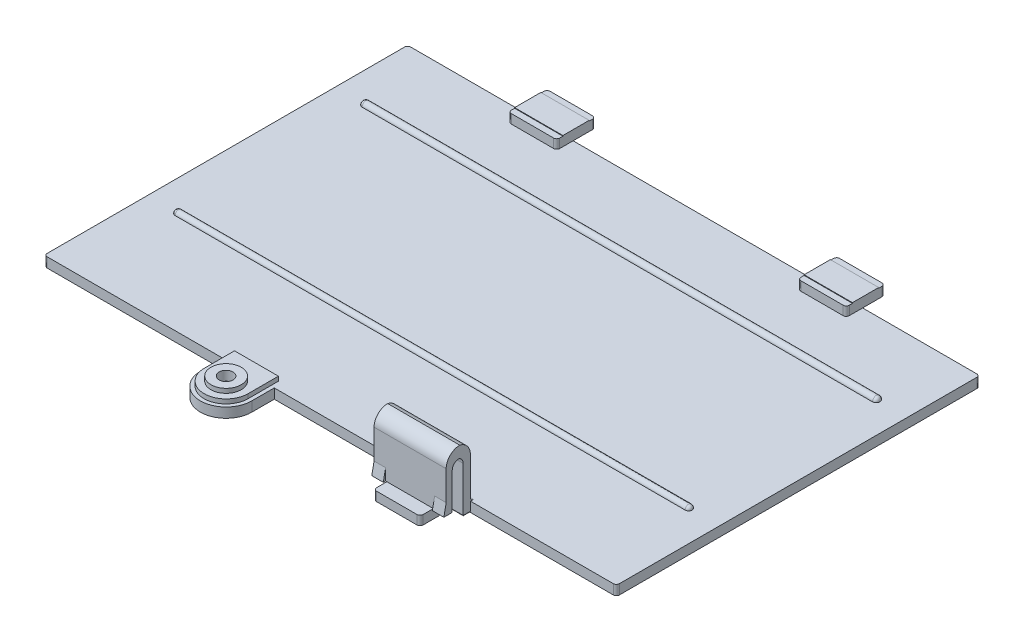
from build123d import *

# Parameters (mm, degrees)
CROQUIS1_W                    = 94.46
CROQUIS1_H                    = 60
SALIENTE_EXTRUIR1_DEPTH       = 1.62
CROQUIS2_W                    = 85.43
CROQUIS2_H                    = 1.25
SALIENTE_EXTRUIR3_DEPTH       = 0.7
CORTAR_EXTRUIR2_REACH         = 110.146
REDONDEO2_R                   = 0.575
REDONDEO3_R                   = 0.575
CROQUIS7_W                    = 85.365
CROQUIS7_H                    = 1.15
SALIENTE_EXTRUIR4_DEPTH       = 0.7
CORTAR_EXTRUIR3_REACH         = 110.092
REDONDEO4_R                   = 0.575
REDONDEO5_R                   = 0.575
CROQUIS9_W                    = 7.98
CROQUIS9_H                    = 6.39
SALIENTE_EXTRUIR6_DEPTH       = 1.6
CROQUIS10_W                   = 7.98
CROQUIS10_H                   = 1.03
CORTAR_EXTRUIR4_DEPTH         = 0.1
REDONDEO7_R                   = 0.5
REDONDEO8_R                   = 0.5
CROQUIS11_W                   = 7.98
CROQUIS11_H                   = 1.03
CORTAR_EXTRUIR5_DEPTH         = 0.1
REDONDEO10_R                  = 0.5
REDONDEO11_R                  = 0.5
REDONDEO13_R                  = 0.5
REDONDEO15_R                  = 0.5
SALIENTE_EXTRUIR8_DEPTH       = 1.48
SALIENTE_EXTRUIR8_DEPTH_BACK  = 1.62
CORTAR_EXTRUIR8_START         = -1.48
CORTAR_EXTRUIR8_DEPTH         = 1.48
CORTAR_EXTRUIR9_START         = -0.76
CORTAR_EXTRUIR9_DEPTH         = 0.76
CROQUIS17_R                   = 2.5
SALIENTE_EXTRUIR9_DEPTH       = 0.72
CROQUIS18_R                   = 1.15
CORTAR_EXTRUIR11_DEPTH        = 114.961386526
CROQUIS20_R                   = 2.36
CORTAR_EXTRUIR12_DEPTH        = 1.5
SALIENTE_EXTRUIR10_DEPTH      = 8.88
SALIENTE_EXTRUIR10_DEPTH_BACK = 1.62
CROQUIS21_W                   = 11.9
CROQUIS21_H                   = 1.18
CROQUIS22_W                   = 11.9
CROQUIS22_H                   = 1.86
SALIENTE_EXTRUIR11_DEPTH      = 2.82
CROQUIS23_W                   = 11.9
CROQUIS23_H                   = 1
SALIENTE_EXTRUIR12_DEPTH      = 8.64
REDONDEO16_R                  = 2.25
REDONDEO18_R                  = 0.5
REDONDEO19_R                  = 2.25
REDONDEO21_R                  = 1.125
REDONDEO22_R                  = 1.125
CROQUIS24_W                   = 7.68
CROQUIS24_H                   = 1.5
SALIENTE_EXTRUIR14_DEPTH      = 2.2
CORTAR_EXTRUIR13_REACH        = 118.677
CROQUIS26_W                   = 2.11
CROQUIS26_H                   = 1.5
REDONDEO25_R                  = 0.5
REDONDEO26_R                  = 0.5
SALIENTE_EXTRUIR21_DEPTH      = 1.9
SALIENTE_EXTRUIR22_DEPTH      = 1.9
REDONDEO27_R                  = 0.5
REDONDEO28_R                  = 0.5
REDONDEO29_R                  = 0.5
REDONDEO30_R                  = 0.5
CROQUIS30_W                   = 9
CROQUIS30_H                   = 1
SALIENTE_EXTRUIR23_DEPTH      = 0.1
REDONDEO31_R                  = 0.2
SALIENTE_EXTRUIR24_DEPTH      = 0.1
CROQUIS32_W                   = 1.8
CROQUIS32_H                   = 7
SALIENTE_EXTRUIR25_DEPTH      = 0.1


# Some blends are built 0.0001 mm under size
with BuildPart() as part:
    # Croquis1 → Saliente-Extruir1 (new body)
    with BuildSketch(Plane(origin=(0, 0, 0), x_dir=(1, 0, 0), z_dir=(0, 1, 0))):
        with Locations((47.23, 30)):
            Rectangle(CROQUIS1_W, CROQUIS1_H)
    extrude(amount=SALIENTE_EXTRUIR1_DEPTH)

    # Croquis2 → Saliente-Extruir3 (add)
    with BuildSketch(Plane(origin=(0, 1.62, 0), x_dir=(1, 0, 0), z_dir=(0, 1, 0))):
        with Locations((47.23, 48.015)):
            Rectangle(CROQUIS2_W, CROQUIS2_H)
    extrude(amount=SALIENTE_EXTRUIR3_DEPTH)

    # Croquis5 → Cortar-Extruir2 (cut, up to next)
    with BuildSketch(Plane.ZY.offset(-4.515), mode=Mode.PRIVATE) as cortar_extruir2_sk1:
        with BuildLine():
            Line((-48.64, 1.62), (-48.64, 2.32))
            Line((-48.64, 2.32), (-47.39, 2.32))
            Line((-47.39, 2.32), (-47.39, 1.62))
            ThreePointArc((-47.39, 1.62), (-48.015, 2.245), (-48.64, 1.62))
        make_face()
    cortar_extruir2_tool1 = extrude(cortar_extruir2_sk1.sketch, amount=-CORTAR_EXTRUIR2_REACH, mode=Mode.PRIVATE) & part.part
    add(cortar_extruir2_tool1.solids().sort_by_distance((4.515, 1.97, -48.625673))[0], mode=Mode.SUBTRACT)

    # Redondeo2
    redondeo2_edges = [part.edges().sort_by_distance(p)[0] for p in [
        (89.945, 2.245, -48.015),
    ]]
    fillet(redondeo2_edges, radius=REDONDEO2_R)

    # Redondeo3
    redondeo3_edges = [part.edges().sort_by_distance(p)[0] for p in [
        (4.515, 2.245, -48.015),
    ]]
    fillet(redondeo3_edges, radius=REDONDEO3_R)

    # Croquis7 → Saliente-Extruir4 (add)
    with BuildSketch(Plane(origin=(0, 1.62, 0), x_dir=(1, 0, 0), z_dir=(0, 1, 0))):
        with Locations((47.2625, 17.025)):
            Rectangle(CROQUIS7_W, CROQUIS7_H)
    extrude(amount=SALIENTE_EXTRUIR4_DEPTH)

    # Croquis8 → Cortar-Extruir3 (cut, up to next)
    with BuildSketch(Plane.ZY.offset(-4.58), mode=Mode.PRIVATE) as cortar_extruir3_sk1:
        with BuildLine():
            Line((-17.6, 1.62), (-17.6, 2.32))
            Line((-17.6, 2.32), (-16.45, 2.32))
            Line((-16.45, 2.32), (-16.45, 1.62))
            ThreePointArc((-16.45, 1.62), (-17.025, 2.195), (-17.6, 1.62))
        make_face()
    cortar_extruir3_tool1 = extrude(cortar_extruir3_sk1.sketch, amount=-CORTAR_EXTRUIR3_REACH, mode=Mode.PRIVATE) & part.part
    add(cortar_extruir3_tool1.solids().sort_by_distance((4.58, 1.97, -17.586537))[0], mode=Mode.SUBTRACT)

    # Redondeo4
    redondeo4_edges = [part.edges().sort_by_distance(p)[0] for p in [
        (4.58, 2.195, -17.025),
    ]]
    fillet(redondeo4_edges, radius=REDONDEO4_R - 0.0001)  # a hair under: the kernel refuses the full size

    # Redondeo5
    redondeo5_edges = [part.edges().sort_by_distance(p)[0] for p in [
        (89.945, 2.195, -17.025),
    ]]
    fillet(redondeo5_edges, radius=REDONDEO5_R - 0.0001)  # a hair under: the kernel refuses the full size

    # Croquis9 → Saliente-Extruir6 (add)
    with BuildSketch(Plane(origin=(0, 1.62, 0), x_dir=(1, 0, 0), z_dir=(0, 1, 0))):
        with Locations((23.33, 60.485)):
            Rectangle(CROQUIS9_W, CROQUIS9_H)
        with Locations((71.13, 60.485)):
            Rectangle(CROQUIS9_W, CROQUIS9_H)
    extrude(amount=SALIENTE_EXTRUIR6_DEPTH)

    # Croquis10 → Cortar-Extruir4 (cut)
    with BuildSketch(Plane(origin=(0, 3.22, 0), x_dir=(1, 0, 0), z_dir=(0, 1, 0))):
        with Locations((23.33, 63.165)):
            Rectangle(CROQUIS10_W, CROQUIS10_H)
        with Locations((23.33, 57.805)):
            Rectangle(CROQUIS10_W, CROQUIS10_H)
    extrude(amount=-CORTAR_EXTRUIR4_DEPTH, mode=Mode.SUBTRACT)

    # Redondeo7
    redondeo7_edges = [part.edges().sort_by_distance(p)[0] for p in [
        (19.34, 2.37, -63.68),
    ]]
    fillet(redondeo7_edges, radius=REDONDEO7_R)

    # Redondeo8
    redondeo8_edges = [part.edges().sort_by_distance(p)[0] for p in [
        (27.32, 2.37, -63.68),
        (27.32, 2.37, -57.29),
        (19.34, 2.37, -57.29),
    ]]
    fillet(redondeo8_edges, radius=REDONDEO8_R)

    # Croquis11 → Cortar-Extruir5 (cut)
    with BuildSketch(Plane(origin=(0, 3.22, 0), x_dir=(1, 0, 0), z_dir=(0, 1, 0))):
        with Locations((71.13, 63.165)):
            Rectangle(CROQUIS11_W, CROQUIS11_H)
        with Locations((71.13, 57.805)):
            Rectangle(CROQUIS11_W, CROQUIS11_H)
    extrude(amount=-CORTAR_EXTRUIR5_DEPTH, mode=Mode.SUBTRACT)

    # Redondeo10
    redondeo10_edges = [part.edges().sort_by_distance(p)[0] for p in [
        (75.12, 2.37, -57.29),
    ]]
    fillet(redondeo10_edges, radius=REDONDEO10_R)

    # Redondeo11
    redondeo11_edges = [part.edges().sort_by_distance(p)[0] for p in [
        (67.14, 2.37, -57.29),
    ]]
    fillet(redondeo11_edges, radius=REDONDEO11_R)

    # Redondeo13
    redondeo13_edges = [part.edges().sort_by_distance(p)[0] for p in [
        (67.14, 2.37, -63.68),
    ]]
    fillet(redondeo13_edges, radius=REDONDEO13_R)

    # Redondeo15
    redondeo15_edges = [part.edges().sort_by_distance(p)[0] for p in [
        (75.12, 2.37, -63.68),
    ]]
    fillet(redondeo15_edges, radius=REDONDEO15_R)

    # Croquis12 → Saliente-Extruir8 (add, two sides: drawn at the far end of the back side and taken through both)
    with BuildSketch(Plane(origin=(0, 1.62, 0), x_dir=(1, 0, 0), z_dir=(0, 1, 0)).offset(-SALIENTE_EXTRUIR8_DEPTH_BACK)):
        with BuildLine():
            Line((37.98, 1.3), (29.5, 1.3))
            Line((29.5, 1.3), (29.5, -3.71))
            ThreePointArc((29.5, -3.71), (33.74, -7.95), (37.98, -3.71))
            Line((37.98, -3.71), (37.98, 1.3))
        make_face()
    extrude(amount=SALIENTE_EXTRUIR8_DEPTH + SALIENTE_EXTRUIR8_DEPTH_BACK)

    # Croquis14 → Cortar-Extruir8 (cut)
    with BuildSketch(Plane(origin=(0, 3.1, 0), x_dir=(1, 0, 0), z_dir=(0, 1, 0)).offset(CORTAR_EXTRUIR8_START)):
        with BuildLine():
            Line((30.115, 1.3), (30.115, -3.71))
            ThreePointArc((30.115, -3.71), (33.74, -7.335), (37.365, -3.71))
            Line((37.365, -3.71), (37.365, 1.3))
            Line((37.365, 1.3), (37.98, 1.3))
            Line((37.98, 1.3), (37.98, -3.71))
            ThreePointArc((37.98, -3.71), (33.74, -7.95), (29.5, -3.71))
            Line((29.5, -3.71), (29.5, 1.3))
            Line((29.5, 1.3), (30.115, 1.3))
        make_face()
    extrude(amount=CORTAR_EXTRUIR8_DEPTH, mode=Mode.SUBTRACT)

    # Croquis16 → Cortar-Extruir9 (cut)
    with BuildSketch(Plane(origin=(0, 3.1, 0), x_dir=(1, 0, 0), z_dir=(0, 1, 0)).offset(CORTAR_EXTRUIR9_START)):
        with BuildLine():
            Line((30.115, -3.71), (30.115, 1.3))
            Line((30.115, 1.3), (37.365, 1.3))
            Line((37.365, 1.3), (37.365, -3.71))
            ThreePointArc((37.365, -3.71), (33.74, -7.335), (30.115, -3.71))
        make_face()
    extrude(amount=CORTAR_EXTRUIR9_DEPTH, mode=Mode.SUBTRACT)

    # Croquis17 → Saliente-Extruir9 (add)
    with BuildSketch(Plane(origin=(0, 2.34, 0), x_dir=(1, 0, 0), z_dir=(0, 1, 0))):
        with Locations(Location((33.74, -3.71, 0), (0, 0, 270))):
            Circle(CROQUIS17_R)
    extrude(amount=SALIENTE_EXTRUIR9_DEPTH)

    # Croquis18 → Cortar-Extruir11 (cut, through all)
    with BuildSketch(Plane(origin=(0, 3.06, 0), x_dir=(1, 0, 0), z_dir=(0, 1, 0))):
        with Locations(Location((33.74, -3.71, 0), (0, 0, 270))):
            Circle(CROQUIS18_R)
    extrude(amount=-CORTAR_EXTRUIR11_DEPTH, mode=Mode.SUBTRACT)

    # Croquis20 → Cortar-Extruir12 (cut)
    with BuildSketch(Plane.XZ):
        with Locations(Location((33.74, 3.71, 0), (0, 0, 270))):
            Circle(CROQUIS20_R)
    extrude(amount=-CORTAR_EXTRUIR12_DEPTH, mode=Mode.SUBTRACT)

    # Croquis21 → Saliente-Extruir10 (add, two sides: drawn at the far end of the back side and taken through both)
    with BuildSketch(Plane(origin=(0, 1.62, 0), x_dir=(1, 0, 0), z_dir=(0, 1, 0)).offset(-SALIENTE_EXTRUIR10_DEPTH_BACK)):
        with Locations((64.41, -0.59)):
            Rectangle(CROQUIS21_W, CROQUIS21_H)
    extrude(amount=SALIENTE_EXTRUIR10_DEPTH + SALIENTE_EXTRUIR10_DEPTH_BACK)

    # Croquis22 → Saliente-Extruir11 (add)
    with BuildSketch(Plane.XY.offset(1.18)):
        with Locations((64.41, 9.57)):
            Rectangle(CROQUIS22_W, CROQUIS22_H)
    extrude(amount=SALIENTE_EXTRUIR11_DEPTH)

    # Croquis23 → Saliente-Extruir12 (add)
    with BuildSketch(Plane.XZ.offset(-8.64)):
        with Locations((64.41, 3.5)):
            Rectangle(CROQUIS23_W, CROQUIS23_H)
    extrude(amount=SALIENTE_EXTRUIR12_DEPTH)

    # Redondeo16
    redondeo16_edges = [part.edges().sort_by_distance(p)[0] for p in [
        (64.41, 10.5, 4),
    ]]
    fillet(redondeo16_edges, radius=REDONDEO16_R)

    # Redondeo18
    redondeo18_edges = [part.edges().sort_by_distance(p)[0] for p in [
        (64.41, 1.62, 0),
    ]]
    fillet(redondeo18_edges, radius=REDONDEO18_R)

    # Redondeo19
    # the kernel refuses this fillet: 2.25 mm, written as the material it takes off along each edge
    with BuildSketch(Plane(origin=(75.844352742, 10.5, 0), x_dir=(0, -1, 0), z_dir=(-1, 0, 0))) as redondeo19_piece_1:
        with BuildLine():
            CenterArc((2.193741097, 2.25), REDONDEO19_R, 192.839588407, 77.160411593)
            Line((0, 1.75), (-0.043874822, 1.74))
            ThreePointArc((-0.043874822, 1.74), (-0.045, 0.875), (-0.045, 0))
            Line((-0.045, 0), (0, -0.045))
            Line((0, -0.045), (2.193741097, -0.045))
            Line((2.193741097, -0.045), (2.193741097, 0))
        make_face()
    extrude(amount=22.868705484, mode=Mode.SUBTRACT)

    # Redondeo21
    redondeo21_edges = [part.edges().sort_by_distance(p)[0] for p in [
        (64.41, 8.64, 3),
    ]]
    fillet(redondeo21_edges, radius=REDONDEO21_R)

    # Redondeo22
    # the kernel refuses this fillet: 1.125 mm, written as the material it adds along each edge
    with BuildSketch(Plane(origin=(58.46, 8.64, 1.18), x_dir=(0, 0, 1), z_dir=(1, 0, 0))) as redondeo22_piece_1:
        with BuildLine():
            CenterArc((1.125, 1.039579242), REDONDEO22_R, 180, 67.528599686)
            Line((0, 1.039579242), (-0.0225, 1.039579242))
            Line((-0.0225, 1.039579242), (-0.0225, 0))
            Line((-0.0225, 0), (0, -0.0225))
            ThreePointArc((0, -0.0225), (0.3475, -0.0225), (0.6864, -0.020791585))
            Line((0.6864, -0.020791585), (0.695, 0))
        make_face()
    extrude(amount=11.9)

    # Croquis24 → Saliente-Extruir14 (add)
    with BuildSketch(Plane.XY.offset(4)):
        with Locations((64.41, 0.75)):
            Rectangle(CROQUIS24_W, CROQUIS24_H)
    extrude(amount=SALIENTE_EXTRUIR14_DEPTH)

    # Croquis26 → Cortar-Extruir13 (cut, up to next)
    with BuildSketch(Plane.XY.offset(4), mode=Mode.PRIVATE) as cortar_extruir13_sk1:
        with Locations((59.515, 0.75)):
            Rectangle(CROQUIS26_W, CROQUIS26_H)
    cortar_extruir13_tool1 = extrude(cortar_extruir13_sk1.sketch, amount=-CORTAR_EXTRUIR13_REACH, mode=Mode.PRIVATE) & part.part
    # Croquis26 → Cortar-Extruir13 (cut, up to next)
    with BuildSketch(Plane.XY.offset(4), mode=Mode.PRIVATE) as cortar_extruir13_sk2:
        with Locations((69.305, 0.75)):
            Rectangle(CROQUIS26_W, CROQUIS26_H)
    cortar_extruir13_tool2 = extrude(cortar_extruir13_sk2.sketch, amount=-CORTAR_EXTRUIR13_REACH, mode=Mode.PRIVATE) & part.part
    add(cortar_extruir13_tool1.solids().sort_by_distance((59.515, 0.75, 4))[0], mode=Mode.SUBTRACT)
    add(cortar_extruir13_tool2.solids().sort_by_distance((69.305, 0.75, 4))[0], mode=Mode.SUBTRACT)

    # Redondeo25
    redondeo25_edges = [part.edges().sort_by_distance(p)[0] for p in [
        (68.25, 0.75, 6.2),
    ]]
    fillet(redondeo25_edges, radius=REDONDEO25_R)

    # Redondeo26
    redondeo26_edges = [part.edges().sort_by_distance(p)[0] for p in [
        (60.57, 0.75, 6.2),
    ]]
    fillet(redondeo26_edges, radius=REDONDEO26_R)

    # Croquis28 → Saliente-Extruir21 (add)
    with BuildSketch(Plane(origin=(70.36, 0, 0), x_dir=(0, 0, -1), z_dir=(1, 0, 0))):
        Polygon((-4, 1.5), (-4.38, 1.5), (-4, 3.4), align=None)
    extrude(amount=-SALIENTE_EXTRUIR21_DEPTH)

    # Croquis29 → Saliente-Extruir22 (add)
    with BuildSketch(Plane.ZY.offset(-58.46)):
        Polygon((4, 1.5), (4.38, 1.5), (4, 3.4), align=None)
    extrude(amount=-SALIENTE_EXTRUIR22_DEPTH)

    # Redondeo27
    redondeo27_edges = [part.edges().sort_by_distance(p)[0] for p in [
        (94.46, 0.81, 0),
    ]]
    fillet(redondeo27_edges, radius=REDONDEO27_R)

    # Redondeo28
    redondeo28_edges = [part.edges().sort_by_distance(p)[0] for p in [
        (94.46, 0.81, -60),
    ]]
    fillet(redondeo28_edges, radius=REDONDEO28_R)

    # Redondeo29
    redondeo29_edges = [part.edges().sort_by_distance(p)[0] for p in [
        (0, 0.81, -60),
    ]]
    fillet(redondeo29_edges, radius=REDONDEO29_R)

    # Redondeo30
    redondeo30_edges = [part.edges().sort_by_distance(p)[0] for p in [
        (0, 0.81, 0),
    ]]
    fillet(redondeo30_edges, radius=REDONDEO30_R)

    # Croquis30 → Saliente-Extruir23 (add)
    # profile 1 of 7: a face of its own
    with BuildSketch(Plane.XZ):
        with Locations((64.41, -4.52)):
            Rectangle(CROQUIS30_W, CROQUIS30_H)
    # profile 2 of 7: a face of its own
    with BuildSketch(Plane.XZ):
        with Locations((64.41, -6.52)):
            Rectangle(CROQUIS30_W, CROQUIS30_H)
    # profile 3 of 7: a face of its own
    with BuildSketch(Plane.XZ):
        Polygon((59.91, -8.02), (64.41, -10.92), (68.91, -8.02), align=None)
    # profile 4 of 7: a face of its own
    with BuildSketch(Plane.XZ):
        with BuildLine():
            add(Edge.make_bspline(
                [(61.867379279, -1.50061664), (61.866546273, -1.565711424), (61.864939041, -1.691307687), (61.850395686, -1.87298038), (61.827401162, -2.041027818), (61.7935672, -2.195326159), (61.753507998, -2.336534157), (61.70453195, -2.464413762), (61.651015323, -2.580401217), (61.589625592, -2.683228133), (61.521649775, -2.772643515), (61.449877728, -2.85145662), (61.370651828, -2.916393318), (61.286946121, -2.96990985), (61.198841712, -3.010506085), (61.108370383, -3.040409738), (61.015162551, -3.057614171), (60.952234142, -3.060193049), (60.92065518, -3.061487191)],
                knots=[0, 0, 0, 0, 1.538128246, 2.967721068, 4.304302333, 5.543284427, 6.697985836, 7.769667469, 8.77629514, 9.713516601, 10.593263134, 11.427282513, 12.226466033, 13.006803676, 13.769053783, 14.512853781, 15.253714915, 16, 16, 16, 16], degree=3))
            add(Edge.make_bspline(
                [(60.92065518, -3.061487191), (60.883392096, -3.060156063), (60.811076513, -3.057572773), (60.705937818, -3.038190142), (60.608297866, -3.005664933), (60.517881631, -2.959620374), (60.436132882, -2.900081437), (60.360271005, -2.830373176), (60.293167975, -2.7479157), (60.232873487, -2.65468212), (60.180739955, -2.549726406), (60.135503614, -2.434278839), (60.09743471, -2.30799299), (60.066430885, -2.171636946), (60.042986392, -2.025058422), (60.026277901, -1.869556022), (60.015863682, -1.705021005), (60.014670796, -1.592448534), (60.014058037, -1.534622535)],
                knots=[0, 0, 0, 0, 0.89744379, 1.741647861, 2.565552371, 3.369238545, 4.175630055, 4.995013918, 5.844730713, 6.729519199, 7.665081684, 8.663147666, 9.713684908, 10.839945409, 12.029750041, 13.287996519, 14.606903512, 16, 16, 16, 16], degree=3))
            add(Edge.make_bspline(
                [(60.014058037, -1.534622535), (60.014880734, -1.470206391), (60.016470374, -1.345739546), (60.031193465, -1.165701154), (60.053535842, -0.99858128), (60.086328826, -0.844581921), (60.126727238, -0.70328808), (60.175393648, -0.575416752), (60.228394333, -0.459251146), (60.29006993, -0.356777633), (60.357432425, -0.266429693), (60.430238593, -0.188385902), (60.508447314, -0.122770047), (60.591993779, -0.070252718), (60.679325813, -0.029305096), (60.769683377, 0.000377022), (60.862869888, 0.017622406), (60.925801152, 0.020195801), (60.957381546, 0.021487191)],
                knots=[0, 0, 0, 0, 1.526809935, 2.950148935, 4.279510268, 5.521231311, 6.679536337, 7.759588672, 8.762209813, 9.702356174, 10.589141914, 11.42943304, 12.226974511, 13.002332201, 13.7620914, 14.508212664, 15.251385893, 16, 16, 16, 16], degree=3))
            add(Edge.make_bspline(
                [(60.957381546, 0.021487191), (60.994649268, 0.020194257), (61.06723848, 0.01767591), (61.172429176, -0.0023156), (61.269978696, -0.035830957), (61.359989391, -0.08249776), (61.441929205, -0.141919331), (61.517746449, -0.211684811), (61.58492232, -0.294093815), (61.644901927, -0.38738651), (61.697902014, -0.491379618), (61.743987105, -0.605868727), (61.782841832, -0.731198549), (61.813442631, -0.867079177), (61.837752733, -1.012645817), (61.85542296, -1.167446816), (61.865480512, -1.331131482), (61.86673655, -1.443246232), (61.867379279, -1.50061664)],
                knots=[0, 0, 0, 0, 0.899673576, 1.752363491, 2.574895721, 3.383086773, 4.19148184, 5.012901541, 5.864729541, 6.751716369, 7.687202652, 8.679609429, 9.729134966, 10.852856786, 12.041109522, 13.292207452, 14.614391397, 16, 16, 16, 16], degree=3))
        make_face()
        with BuildLine():
            add(Edge.make_bspline(
                [(61.529360689, -1.530541827), (61.529009642, -1.487458167), (61.52832196, -1.403059617), (61.521746853, -1.279244046), (61.512896521, -1.160953054), (61.498449678, -1.04887935), (61.480357967, -0.943248034), (61.457755258, -0.844664458), (61.428997276, -0.753821626), (61.395909148, -0.670673636), (61.358109317, -0.595350946), (61.314657423, -0.529014243), (61.26568694, -0.471722301), (61.212101638, -0.4228271), (61.152260766, -0.384086661), (61.086448885, -0.356553387), (61.014664065, -0.339794742), (60.964729091, -0.337906936), (60.939018363, -0.336934935)],
                knots=[0, 0, 0, 0, 1.399807427, 2.742146727, 4.028058115, 5.253333614, 6.412333134, 7.509445534, 8.536879352, 9.505369606, 10.414646269, 11.270713468, 12.075314869, 12.857759492, 13.619933087, 14.379253425, 15.16550323, 16, 16, 16, 16], degree=3))
            add(Edge.make_bspline(
                [(60.939018363, -0.336934935), (60.914208355, -0.338156578), (60.865795791, -0.340540408), (60.795614494, -0.357960733), (60.730967907, -0.387385633), (60.672792966, -0.429159481), (60.620204326, -0.480410883), (60.57181011, -0.539597012), (60.529005294, -0.607679831), (60.491073197, -0.683410654), (60.457914676, -0.766535578), (60.429513139, -0.856881544), (60.405049912, -0.954044633), (60.385653859, -1.057653174), (60.370974553, -1.166200747), (60.360196185, -1.278503739), (60.353025477, -1.394198213), (60.352395786, -1.472494209), (60.352076627, -1.512178644)],
                knots=[0, 0, 0, 0, 0.822581759, 1.605130122, 2.382565749, 3.165077969, 3.968280042, 4.81284823, 5.695408039, 6.630468685, 7.619276448, 8.661094866, 9.770159564, 10.941364913, 12.1560516, 13.402841977, 14.683626806, 16, 16, 16, 16], degree=3))
            add(Edge.make_bspline(
                [(60.352076627, -1.512178644), (60.352454759, -1.555486646), (60.35319558, -1.64033373), (60.359382159, -1.764654647), (60.369552259, -1.883303532), (60.383400678, -1.995726267), (60.402275525, -2.101358199), (60.426157705, -2.199402387), (60.453642681, -2.29004874), (60.48608343, -2.372895096), (60.524101697, -2.447195915), (60.567097009, -2.513378807), (60.615515698, -2.570741365), (60.668636112, -2.619850547), (60.727935853, -2.658812386), (60.793447424, -2.686016008), (60.864491654, -2.70290185), (60.913757814, -2.704808121), (60.939018363, -2.705785536)],
                knots=[0, 0, 0, 0, 1.410519436, 2.763426031, 4.053008684, 5.288523313, 6.451568993, 7.545823135, 8.573500885, 9.534699043, 10.439563925, 11.287439667, 12.099579822, 12.878408891, 13.63619662, 14.397322716, 15.178249175, 16, 16, 16, 16], degree=3))
            add(Edge.make_bspline(
                [(60.939018363, -2.705785536), (60.963816131, -2.704527618), (61.01242496, -2.702061835), (61.082785527, -2.685087815), (61.147264274, -2.654904608), (61.206206235, -2.613693691), (61.258661913, -2.561628118), (61.308612678, -2.503367098), (61.350907263, -2.434806465), (61.389697581, -2.35936913), (61.423809095, -2.276142771), (61.451636945, -2.185525822), (61.476438449, -2.088697311), (61.4958353, -1.985528131), (61.510456584, -1.87719942), (61.521242894, -1.764896979), (61.528425214, -1.648975967), (61.529045442, -1.570453067), (61.529360689, -1.530541827)],
                knots=[0, 0, 0, 0, 0.821426458, 1.610168256, 2.379688541, 3.167249454, 3.979942776, 4.822320955, 5.703641224, 6.640795507, 7.631038197, 8.678552789, 9.778778138, 10.940960309, 12.15394099, 13.398980273, 14.677966262, 16, 16, 16, 16], degree=3))
        make_face(mode=Mode.SUBTRACT)
    # profile 5 of 7: a face of its own
    with BuildSketch(Plane.XZ):
        with BuildLine():
            add(Edge.make_bspline(
                [(64.085470415, -0.938159148), (64.084796348, -0.968788221), (64.083449491, -1.029988411), (64.07316048, -1.121486422), (64.054865998, -1.212187755), (64.031775456, -1.302299038), (64.000644049, -1.389831523), (63.961750319, -1.473204808), (63.915307118, -1.551821516), (63.861347129, -1.625384765), (63.800420806, -1.694235218), (63.729358594, -1.754483611), (63.651549677, -1.809402698), (63.565620655, -1.857097916), (63.471330385, -1.896688634), (63.367700872, -1.922916555), (63.255894336, -1.9408483), (63.178270668, -1.942511794), (63.138066198, -1.943373385)],
                knots=[0, 0, 0, 0, 0.946493284, 1.891195612, 2.840666314, 3.804224166, 4.763774567, 5.707229007, 6.643266074, 7.580770366, 8.523365926, 9.477092342, 10.452850498, 11.462724217, 12.508817372, 13.603252224, 14.75862638, 16, 16, 16, 16], degree=3))
            Line((63.138066198, -1.943373385), (62.842214917, -1.943373385))
            Line((62.842214917, -1.943373385), (62.842214917, -3.02))
            Line((62.842214917, -3.02), (62.517118567, -3.02))
            Line((62.517118567, -3.02), (62.517118567, -0.02))
            Line((62.517118567, -0.02), (63.189755158, -0.02))
            add(Edge.make_bspline(
                [(63.189755158, -0.02), (63.219017226, -0.020770159), (63.276991015, -0.022295991), (63.363030036, -0.030940551), (63.447044005, -0.046989243), (63.52913965, -0.068253885), (63.607938512, -0.096844856), (63.683111108, -0.131946093), (63.752164406, -0.176652734), (63.81693201, -0.227837708), (63.875715944, -0.287374776), (63.928026721, -0.355190827), (63.974875787, -0.43058267), (64.014076106, -0.514634748), (64.04647957, -0.607196369), (64.069318536, -0.709164582), (64.082815524, -0.820589154), (64.084563407, -0.897992916), (64.085470415, -0.938159148)],
                knots=[0, 0, 0, 0, 0.964489542, 1.910839342, 2.845706662, 3.780782928, 4.702482022, 5.604748975, 6.508375881, 7.406799162, 8.320744443, 9.257758693, 10.223925056, 11.239905898, 12.307874609, 13.449675465, 14.676589843, 16, 16, 16, 16], degree=3))
        make_face()
        with BuildLine():
            add(Edge.make_bspline(
                [(63.746771707, -0.956522331), (63.746536811, -0.933145283), (63.746079379, -0.887621243), (63.738008897, -0.821533106), (63.726936016, -0.759550991), (63.710567092, -0.701566302), (63.688737211, -0.64818676), (63.66307128, -0.598611392), (63.631811371, -0.553954988), (63.596690935, -0.513158518), (63.556963224, -0.476852309), (63.513239927, -0.44556924), (63.466035719, -0.418911167), (63.415223431, -0.396941126), (63.360479915, -0.380045721), (63.301992946, -0.367730816), (63.239550333, -0.361203488), (63.196796635, -0.359998829), (63.174792564, -0.359378826)],
                knots=[0, 0, 0, 0, 1.191877709, 2.321041095, 3.39182232, 4.402306498, 5.388195783, 6.329871967, 7.244301714, 8.162673302, 9.071452705, 9.983098347, 10.899866046, 11.832405071, 12.801873121, 13.818166245, 14.877074313, 16, 16, 16, 16], degree=3))
            Line((63.174792564, -0.359378826), (62.842214917, -0.359378826))
            Line((62.842214917, -0.359378826), (62.842214917, -1.594472909))
            Line((62.842214917, -1.594472909), (63.145547495, -1.594472909))
            add(Edge.make_bspline(
                [(63.145547495, -1.594472909), (63.168919008, -1.593929398), (63.214424975, -1.592871145), (63.28061789, -1.585281888), (63.342749917, -1.573134015), (63.400996965, -1.556311119), (63.454832432, -1.533896943), (63.504311106, -1.506171642), (63.550307046, -1.474539177), (63.591171432, -1.436526913), (63.628102256, -1.394297819), (63.660567391, -1.347050267), (63.686769014, -1.293861271), (63.709485347, -1.23622649), (63.726085618, -1.17316383), (63.738576783, -1.105445948), (63.74492012, -1.032588223), (63.746142367, -0.982376556), (63.746771707, -0.956522331)],
                knots=[0, 0, 0, 0, 1.118908191, 2.17859233, 3.185536568, 4.147292364, 5.076648073, 5.970720916, 6.859108653, 7.742641958, 8.635131903, 9.541378467, 10.47831057, 11.468082183, 12.502957517, 13.595221214, 14.761768035, 16, 16, 16, 16], degree=3))
        make_face(mode=Mode.SUBTRACT)
    # profile 6 of 7: a face of its own
    with BuildSketch(Plane.XZ):
        Polygon((66.27159601, -3.02), (64.913400589, -3.02), (64.913400589, -0.02), (66.27159601, -0.02), (66.27159601, -0.364139651), (65.239177057, -0.364139651), (65.239177057, -1.293860803), (66.231469055, -1.293860803), (66.231469055, -1.638000453), (65.239177057, -1.638000453), (65.239177057, -2.671099524), (66.27159601, -2.671099524), align=None)
    # profile 7 of 7: a face of its own
    with BuildSketch(Plane.XZ):
        Polygon((68.706644752, -3.02), (68.282931308, -3.02), (67.586490592, -1.148995693), (67.385175697, -0.54777148), (67.385175697, -2.060353661), (67.385175697, -3.02), (67.081843119, -3.02), (67.081843119, -0.02), (67.50011562, -0.02), (68.163910678, -1.791707096), (68.403312174, -2.477946044), (68.403312174, -0.871507595), (68.403312174, -0.02), (68.706644752, -0.02), align=None)
    extrude(amount=SALIENTE_EXTRUIR23_DEPTH)

    # Redondeo31
    redondeo31_edges = [part.edges().sort_by_distance(p)[0] for p in [
        (70.36, 0, 0.59),
        (64.41, 0, 1.18),
        (58.46, 0, 0.59),
    ]]
    fillet(redondeo31_edges, radius=REDONDEO31_R)

    # Croquis31 → Saliente-Extruir24 (add)
    # profile 1 of 12: a face of its own
    with BuildSketch(Plane.XZ):
        Polygon((56.66, -10.397826087), (56.66, -10.842798913), (56.007826087, -11.04388587), (56.007826087, -12.289809783), (56.66, -12.495652174), (56.66, -12.919565217), (53.66, -11.922282609), (53.66, -11.363179348), align=None)
        Polygon((55.66, -11.150543478), (54.00986413, -11.658695652), (55.66, -12.179755435), align=None, mode=Mode.SUBTRACT)
    # profile 2 of 12: a face of its own
    with BuildSketch(Plane.XZ):
        Polygon((54.007826087, -13.37173913), (54.007826087, -14.241304348), (56.66, -14.241304348), (56.66, -14.676086957), (54.007826087, -14.676086957), (54.007826087, -15.545652174), (53.66, -15.545652174), (53.66, -13.37173913), align=None)
    # profile 3 of 12: a face of its own
    with BuildSketch(Plane.XZ):
        Polygon((54.007826087, -16.193478261), (54.007826087, -17.063043478), (56.66, -17.063043478), (56.66, -17.497826087), (54.007826087, -17.497826087), (54.007826087, -18.367391304), (53.66, -18.367391304), (53.66, -16.193478261), align=None)
    # profile 4 of 12: a face of its own
    with BuildSketch(Plane.XZ):
        Polygon((54.007826087, -20.319565217), (54.007826087, -21.015217391), (53.66, -21.015217391), (53.66, -19.189130435), (54.007826087, -19.189130435), (54.007826087, -19.884782609), (56.312173913, -19.884782609), (56.312173913, -19.189130435), (56.66, -19.189130435), (56.66, -21.015217391), (56.312173913, -21.015217391), (56.312173913, -20.319565217), align=None)
    # profile 5 of 12: a face of its own
    with BuildSketch(Plane.XZ):
        with BuildLine():
            add(Edge.make_bspline(
                [(54.573043478, -21.923913043), (54.603434566, -21.924646437), (54.664489999, -21.926119818), (54.755631876, -21.939748105), (54.84631338, -21.960787855), (54.936000708, -21.989989767), (55.02348924, -22.027353025), (55.106371106, -22.075731001), (55.184548238, -22.132769901), (55.257700492, -22.19920146), (55.325247079, -22.274750638), (55.385900223, -22.360630448), (55.440294282, -22.455834444), (55.487190095, -22.561148623), (55.52631217, -22.676180903), (55.553980928, -22.80234114), (55.570127633, -22.939114042), (55.57205052, -23.033922409), (55.573043478, -23.082880435)],
                knots=[0, 0, 0, 0, 0.848366681, 1.70436134, 2.568101873, 3.44615045, 4.335605672, 5.219738008, 6.120455433, 7.033895829, 7.974606513, 8.94512196, 9.964958472, 11.032269508, 12.160312669, 13.352609154, 14.632915689, 16, 16, 16, 16], degree=3))
            Line((55.573043478, -23.082880435), (55.573043478, -23.445652174))
            Line((55.573043478, -23.445652174), (56.66, -23.445652174))
            Line((56.66, -23.445652174), (56.66, -23.880434783))
            Line((56.66, -23.880434783), (53.66, -23.880434783))
            Line((53.66, -23.880434783), (53.66, -23.041440217))
            add(Edge.make_bspline(
                [(53.66, -23.041440217), (53.660778796, -23.004969686), (53.66232409, -22.932604561), (53.670830726, -22.825198916), (53.687101676, -22.720342047), (53.707216991, -22.617861513), (53.735901024, -22.519797823), (53.770627471, -22.426745599), (53.814894376, -22.340648913), (53.86553256, -22.260009651), (53.924742366, -22.186547952), (53.991765389, -22.120565217), (54.067380925, -22.063344989), (54.150533678, -22.013236801), (54.242967438, -21.972562635), (54.345078276, -21.944785673), (54.455980583, -21.926310745), (54.533107613, -21.924731016), (54.573043478, -21.923913043)],
                knots=[0, 0, 0, 0, 1.071168916, 2.125422097, 3.160883342, 4.185978661, 5.189866953, 6.158124041, 7.097919914, 8.02771025, 8.949955167, 9.862244431, 10.782641377, 11.728090455, 12.707834548, 13.737299276, 14.82838854, 16, 16, 16, 16], degree=3))
        make_face()
        with BuildLine():
            add(Edge.make_bspline(
                [(54.596141304, -22.358695652), (54.573012512, -22.35912936), (54.527933632, -22.359974673), (54.4626506, -22.369061339), (54.401456116, -22.383370272), (54.344403212, -22.402861106), (54.29132206, -22.428128285), (54.242938775, -22.459721851), (54.198243524, -22.496640835), (54.158290434, -22.53951073), (54.123121668, -22.587489224), (54.091331267, -22.639136132), (54.065641885, -22.696116578), (54.044816733, -22.757646583), (54.027504953, -22.823386349), (54.01661034, -22.893973265), (54.008521211, -22.968562516), (54.008061508, -23.019903282), (54.007826087, -23.046195652)],
                knots=[0, 0, 0, 0, 1.07893025, 2.102875295, 3.069403633, 4.00867391, 4.911619206, 5.805799344, 6.69897942, 7.61127936, 8.532960211, 9.47193309, 10.436783978, 11.442898866, 12.50165651, 13.605056338, 14.773513735, 16, 16, 16, 16], degree=3))
            Line((54.007826087, -23.046195652), (54.007826087, -23.445652174))
            Line((54.007826087, -23.445652174), (55.225217391, -23.445652174))
            Line((55.225217391, -23.445652174), (55.225217391, -23.080842391))
            add(Edge.make_bspline(
                [(55.225217391, -23.080842391), (55.224599598, -23.052752482), (55.223402026, -22.998301165), (55.216898029, -22.918781355), (55.204591239, -22.844347199), (55.188087518, -22.774575142), (55.16512652, -22.710547778), (55.139017273, -22.650741512), (55.106759605, -22.596261999), (55.070111963, -22.546440473), (55.02858622, -22.501664943), (54.981101055, -22.463632793), (54.92930211, -22.430720404), (54.872253646, -22.403967776), (54.810060896, -22.383943772), (54.743249593, -22.368912768), (54.671338599, -22.359975203), (54.621755973, -22.359131509), (54.596141304, -22.358695652)],
                knots=[0, 0, 0, 0, 1.232741143, 2.389626019, 3.497154964, 4.540654912, 5.530551031, 6.477891969, 7.399827849, 8.302062897, 9.187787369, 10.070776652, 10.963938254, 11.875156404, 12.827227449, 13.825219082, 14.876495724, 16, 16, 16, 16], degree=3))
        make_face(mode=Mode.SUBTRACT)
    # profile 6 of 12: a face of its own
    with BuildSketch(Plane.XZ):
        with BuildLine():
            add(Edge.make_bspline(
                [(55.617201087, -24.658695652), (55.657538888, -24.659703456), (55.736611481, -24.661679014), (55.852393438, -24.674372245), (55.962160915, -24.696901136), (56.065794226, -24.727905881), (56.162621318, -24.768251515), (56.25260469, -24.816236505), (56.335022148, -24.873076621), (56.409318221, -24.93875807), (56.4761789, -25.012285949), (56.534699724, -25.093906536), (56.586291743, -25.182509547), (56.627990809, -25.279669462), (56.662177228, -25.383679801), (56.686676126, -25.495379418), (56.700883292, -25.614619704), (56.702597697, -25.69670005), (56.703478261, -25.738858696)],
                knots=[0, 0, 0, 0, 1.115484347, 2.186639785, 3.21576971, 4.210213994, 5.173105984, 6.111664006, 7.02532597, 7.934858562, 8.848069786, 9.767464655, 10.707275202, 11.677530238, 12.685466895, 13.730758442, 14.834457276, 16, 16, 16, 16], degree=3))
            add(Edge.make_bspline(
                [(56.703478261, -25.738858696), (56.702579676, -25.784861402), (56.700853503, -25.873232159), (56.68735925, -26.00055243), (56.664474751, -26.116985122), (56.632862402, -26.223278465), (56.591511228, -26.318683473), (56.544167218, -26.405742498), (56.487411484, -26.482456032), (56.423743516, -26.550625784), (56.3526042, -26.609344403), (56.274545002, -26.658960928), (56.190165455, -26.700930085), (56.09890671, -26.73392528), (56.001667612, -26.758779675), (55.898953876, -26.776225129), (55.790912683, -26.787478031), (55.716867796, -26.788571525), (55.679021739, -26.789130435)],
                knots=[0, 0, 0, 0, 1.312509269, 2.521317747, 3.647901944, 4.69450151, 5.678721736, 6.610106784, 7.516085424, 8.393786192, 9.265807534, 10.140530008, 11.027694131, 11.949639488, 12.904095158, 13.887806173, 14.920408814, 16, 16, 16, 16], degree=3))
            Line((55.679021739, -26.789130435), (53.66, -26.789130435))
            Line((53.66, -26.789130435), (53.66, -26.354347826))
            Line((53.66, -26.354347826), (55.643016304, -26.354347826))
            add(Edge.make_bspline(
                [(55.643016304, -26.354347826), (55.671561187, -26.353990105), (55.726682805, -26.353299326), (55.806748119, -26.34705424), (55.881426491, -26.337075371), (55.950983622, -26.322952859), (56.015523578, -26.304425857), (56.073693841, -26.278926141), (56.127259733, -26.249674204), (56.174965632, -26.214158945), (56.217144936, -26.173070705), (56.254704331, -26.127265424), (56.284915385, -26.074782088), (56.311070921, -26.017371089), (56.331586128, -25.953593054), (56.345254271, -25.883350625), (56.354505084, -25.80658584), (56.355258823, -25.753155339), (56.355652174, -25.725271739)],
                knots=[0, 0, 0, 0, 1.246998361, 2.408017137, 3.506430322, 4.536785721, 5.507205879, 6.433498561, 7.306080547, 8.168847153, 9.022488525, 9.873890797, 10.747761968, 11.659944467, 12.626776921, 13.66682499, 14.782393629, 16, 16, 16, 16], degree=3))
            add(Edge.make_bspline(
                [(56.355652174, -25.725271739), (56.355199068, -25.699206738), (56.354317625, -25.648501504), (56.345569014, -25.575209176), (56.330400449, -25.507281184), (56.310353494, -25.444437903), (56.28381615, -25.386807365), (56.250669129, -25.334913833), (56.212885371, -25.287408879), (56.167862084, -25.246541268), (56.118190758, -25.2107191), (56.06396466, -25.178964912), (56.004628154, -25.152688725), (55.94049662, -25.13093222), (55.87160719, -25.114099006), (55.798063677, -25.101754534), (55.719670376, -25.095319462), (55.66589786, -25.094103314), (55.63826087, -25.093478261)],
                knots=[0, 0, 0, 0, 1.144144692, 2.225747957, 3.234124433, 4.19629321, 5.117141874, 6.01091283, 6.894504528, 7.774058978, 8.67103204, 9.579994104, 10.52798136, 11.515303816, 12.549861162, 13.638525319, 14.786293461, 16, 16, 16, 16], degree=3))
            Line((55.63826087, -25.093478261), (53.66, -25.093478261))
            Line((53.66, -25.093478261), (53.66, -24.658695652))
            Line((53.66, -24.658695652), (55.617201087, -24.658695652))
        make_face()
    # profile 7 of 12: a face of its own
    with BuildSketch(Plane.XZ):
        Polygon((56.66, -30.389130435), (56.66, -30.963179348), (54.784320652, -31.766168478), (54.18173913, -31.997826087), (55.698043478, -31.997826087), (56.66, -31.997826087), (56.66, -32.432608696), (53.66, -32.432608696), (53.66, -31.865353261), (55.446684783, -31.100407609), (56.13826087, -30.823913043), (54.518695652, -30.823913043), (53.66, -30.823913043), (53.66, -30.389130435), align=None)
    # profile 8 of 12: a face of its own
    with BuildSketch(Plane.XZ):
        Polygon((54.007826087, -34.42826087), (54.007826087, -35.123913043), (53.66, -35.123913043), (53.66, -33.297826087), (54.007826087, -33.297826087), (54.007826087, -33.993478261), (56.312173913, -33.993478261), (56.312173913, -33.297826087), (56.66, -33.297826087), (56.66, -35.123913043), (56.312173913, -35.123913043), (56.312173913, -34.42826087), align=None)
    # profile 9 of 12: a face of its own
    with BuildSketch(Plane.XZ):
        Polygon((56.66, -38.984782609), (56.66, -40.680434783), (53.66, -40.680434783), (53.66, -38.984782609), (54.007826087, -38.984782609), (54.007826087, -40.245652174), (54.920869565, -40.245652174), (54.920869565, -39.035054348), (55.268695652, -39.035054348), (55.268695652, -40.245652174), (56.312173913, -40.245652174), (56.312173913, -38.984782609), align=None)
    # profile 10 of 12: a face of its own
    with BuildSketch(Plane.XZ):
        with BuildLine():
            add(Edge.make_bspline(
                [(55.126711957, -41.545652174), (55.197217488, -41.547080967), (55.335524694, -41.549883759), (55.505700702, -41.571781804), (55.636459211, -41.59671238), (55.730082359, -41.621321128), (55.8204529, -41.650571747), (55.907124087, -41.685123144), (55.990448804, -41.724724832), (56.070207109, -41.769111722), (56.144860956, -41.820852073), (56.216714442, -41.876386608), (56.284293722, -41.938153138), (56.346232347, -42.007375202), (56.403482557, -42.082894121), (56.455260606, -42.165447917), (56.501006261, -42.254849156), (56.543356649, -42.350077265), (56.577048624, -42.453309279), (56.607456077, -42.562840255), (56.631093949, -42.679962188), (56.647873738, -42.804763187), (56.658174448, -42.93723556), (56.659380984, -43.028196439), (56.66, -43.07486413)],
                knots=[0, 0, 0, 0, 1.874778086, 3.677659276, 4.555411841, 5.414508245, 6.25076779, 7.080755626, 7.894473888, 8.703653385, 9.505626019, 10.308141413, 11.118150068, 11.937068997, 12.775581797, 13.636302782, 14.525391725, 15.445290438, 16.405354875, 17.410742648, 18.46805968, 19.580643525, 20.758743499, 22, 22, 22, 22], degree=3))
            Line((56.66, -43.07486413), (56.66, -43.719565217))
            Line((56.66, -43.719565217), (53.66, -43.719565217))
            Line((53.66, -43.719565217), (53.66, -42.94375))
            add(Edge.make_bspline(
                [(53.66, -42.94375), (53.660934895, -42.88686862), (53.662749583, -42.77645844), (53.679813446, -42.616463334), (53.70829421, -42.467639593), (53.747133666, -42.329684377), (53.798482747, -42.203192233), (53.860111979, -42.087385455), (53.934198871, -41.983150416), (54.019782303, -41.890041552), (54.116862387, -41.807860619), (54.226332963, -41.73758754), (54.347278697, -41.677644209), (54.480301603, -41.628792364), (54.625430834, -41.591916846), (54.781910106, -41.564966587), (54.950410111, -41.548509362), (55.066664435, -41.546625318), (55.126711957, -41.545652174)],
                knots=[0, 0, 0, 0, 1.17177347, 2.274482801, 3.310388109, 4.291013938, 5.222472681, 6.118087065, 6.988127256, 7.850034114, 8.717518086, 9.601485366, 10.523818561, 11.493740021, 12.515690363, 13.604990885, 14.762933224, 16, 16, 16, 16], degree=3))
        make_face()
        with BuildLine():
            add(Edge.make_bspline(
                [(55.161358696, -41.980434783), (55.110161304, -41.98098503), (55.01171655, -41.982043072), (54.870349137, -41.99285683), (54.74116533, -42.010938225), (54.623779294, -42.036327163), (54.517962536, -42.069853893), (54.422187794, -42.10920503), (54.338381389, -42.15888934), (54.263631826, -42.214550654), (54.200350295, -42.279272526), (54.145389343, -42.350682012), (54.101775373, -42.430839183), (54.06599522, -42.517814476), (54.039959112, -42.612598255), (54.020854795, -42.714828899), (54.010387625, -42.825100474), (54.008697238, -42.901157057), (54.007826087, -42.940353261)],
                knots=[0, 0, 0, 0, 1.413273786, 2.717509377, 3.911113665, 5.012370192, 6.028682814, 6.972739505, 7.863782455, 8.711554031, 9.53824734, 10.354760011, 11.191533455, 12.049501983, 12.946054968, 13.900037449, 14.917772052, 16, 16, 16, 16], degree=3))
            Line((54.007826087, -42.940353261), (54.007826087, -43.284782609))
            Line((54.007826087, -43.284782609), (56.312173913, -43.284782609))
            Line((56.312173913, -43.284782609), (56.312173913, -42.985190217))
            add(Edge.make_bspline(
                [(56.312173913, -42.985190217), (56.311158237, -42.944630036), (56.309183956, -42.86578878), (56.296889589, -42.751222696), (56.273401226, -42.644932029), (56.242317025, -42.546240149), (56.202431059, -42.455145071), (56.152222926, -42.372366711), (56.093668436, -42.297050018), (56.025538487, -42.229811865), (55.948409581, -42.17050719), (55.861956095, -42.119534392), (55.76709912, -42.075899201), (55.663239353, -42.040684389), (55.550379702, -42.013795056), (55.428686024, -41.994220001), (55.297899707, -41.982788803), (55.207803634, -41.981235511), (55.161358696, -41.980434783)],
                knots=[0, 0, 0, 0, 1.112368836, 2.162232858, 3.153671654, 4.092370021, 4.995862172, 5.873374016, 6.740409183, 7.605418486, 8.490978658, 9.401506614, 10.351738463, 11.349303293, 12.403565438, 13.529577563, 14.726485918, 16, 16, 16, 16], degree=3))
        make_face(mode=Mode.SUBTRACT)
    # profile 11 of 12: a face of its own
    with BuildSketch(Plane.XZ):
        Polygon((56.66, -44.258695652), (56.66, -44.703668478), (56.007826087, -44.904755435), (56.007826087, -46.150679348), (56.66, -46.356521739), (56.66, -46.780434783), (53.66, -45.783152174), (53.66, -45.224048913), align=None)
        Polygon((55.66, -45.011413043), (54.00986413, -45.519565217), (55.66, -46.040625), align=None, mode=Mode.SUBTRACT)
    # profile 12 of 12: a face of its own
    with BuildSketch(Plane.XZ):
        Polygon((56.66, -47.181657609), (56.66, -47.580434783), (54.757826087, -47.625951087), (54.075081522, -47.645652174), (54.481331522, -47.78763587), (55.703478261, -48.236684783), (55.703478261, -48.519293478), (54.527527174, -48.94048913), (54.075081522, -49.080434783), (54.790434783, -49.089945652), (56.66, -49.145652174), (56.66, -49.530842391), (53.66, -49.38138587), (53.66, -48.89701087), (54.821684783, -48.493478261), (55.213668478, -48.363043478), (54.821684783, -48.234646739), (53.66, -47.803940217), (53.66, -47.306657609), align=None)
    extrude(amount=SALIENTE_EXTRUIR24_DEPTH)

    # Croquis32 → Saliente-Extruir25 (add)
    # profile 1 of 7: a face of its own
    with BuildSketch(Plane.XZ):
        with Locations((46.33, -30)):
            Rectangle(CROQUIS32_W, CROQUIS32_H)
    # profile 2 of 7: a face of its own
    with BuildSketch(Plane.XZ):
        Polygon((36.877404217, -47.024880979), (36.877404217, -47.569542054), (37.43, -47.569542054), (37.43, -48.004817502), (36.877404217, -48.004817502), (36.877404217, -49.542450691), (36.58438676, -49.542450691), (34.93, -48.180514623), (34.93, -47.569542054), (36.58438676, -47.569542054), (36.58438676, -47.024880979), align=None)
        Polygon((35.251355702, -48.004817502), (36.58438676, -49.116810247), (36.58438676, -48.004817502), align=None, mode=Mode.SUBTRACT)
    # profile 3 of 7: a face of its own
    with BuildSketch(Plane.XZ):
        with BuildLine():
            add(Edge.make_bspline(
                [(36.827528905, -50.772103831), (36.828659149, -50.744967309), (36.830884589, -50.691535788), (36.850400492, -50.614905687), (36.879317233, -50.544992995), (36.918643154, -50.484214655), (36.966615563, -50.43405692), (37.022065333, -50.396331102), (37.083538092, -50.370745202), (37.12710821, -50.367781447), (37.148884607, -50.366300159)],
                knots=[0, 0, 0, 0, 1.135480668, 2.23574925, 3.292992213, 4.294332919, 5.251770645, 6.180631597, 7.090677536, 8, 8, 8, 8], degree=3))
            add(Edge.make_bspline(
                [(37.148884607, -50.366300159), (37.170298035, -50.367755174), (37.212990003, -50.370656039), (37.273037998, -50.396530601), (37.32726387, -50.434082601), (37.374051796, -50.484437642), (37.412727046, -50.54513669), (37.441728644, -50.614891821), (37.461209707, -50.691539444), (37.463439967, -50.744968541), (37.464572659, -50.772103831)],
                knots=[0, 0, 0, 0, 0.901048378, 1.796420804, 2.719858673, 3.674246941, 4.679591627, 5.74563678, 6.855065766, 8, 8, 8, 8], degree=3))
            add(Edge.make_bspline(
                [(37.464572659, -50.772103831), (37.463454081, -50.799615115), (37.461266476, -50.853418958), (37.441956721, -50.930164068), (37.412584975, -50.999235502), (37.3738918, -51.059280987), (37.327276826, -51.109568299), (37.273034708, -51.147107756), (37.212990821, -51.17298549), (37.170298308, -51.175885935), (37.148884607, -51.177340739)],
                knots=[0, 0, 0, 0, 1.16164915, 2.271838299, 3.323916488, 4.323235523, 5.278277723, 6.202348317, 7.098334238, 8, 8, 8, 8], degree=3))
            add(Edge.make_bspline(
                [(37.148884607, -51.177340739), (37.12710793, -51.175859671), (37.08353725, -51.172896358), (37.022068733, -51.147307125), (36.966602346, -51.109594357), (36.918805069, -51.059500618), (36.879461632, -50.999379841), (36.85017238, -50.930149945), (36.83082767, -50.853422763), (36.828644974, -50.799616402), (36.827528905, -50.772103831)],
                knots=[0, 0, 0, 0, 0.909937097, 1.820598159, 2.750086951, 3.708171833, 4.703559141, 5.746940808, 6.847953089, 8, 8, 8, 8], degree=3))
        make_face()
    # profile 4 of 7: a face of its own
    with BuildSketch(Plane.XZ):
        with BuildLine():
            Line((37.43, -52.145715257), (37.43, -54.250113353))
            Line((37.43, -54.250113353), (37.131314895, -54.250113353))
            Line((37.131314895, -54.250113353), (36.488603491, -53.42377012))
            add(Edge.make_bspline(
                [(36.488603491, -53.42377012), (36.463635948, -53.391338621), (36.415808564, -53.329213413), (36.344860787, -53.242293671), (36.279863461, -53.164309509), (36.219291196, -53.09579177), (36.163086922, -53.035201685), (36.109654069, -52.982164679), (36.058667971, -52.936109547), (36.010018208, -52.896664607), (35.962803556, -52.864122646), (35.917923617, -52.836291504), (35.87311326, -52.815977798), (35.815483512, -52.795273557), (35.739920818, -52.780072784), (35.678579715, -52.777731539), (35.646957606, -52.776524598)],
                knots=[0, 0, 0, 0, 1.557756049, 2.98401002, 4.270209825, 5.421538445, 6.464494651, 7.415333653, 8.286008435, 9.078851766, 9.796955325, 10.46781797, 11.085553171, 11.665512875, 12.796542595, 14, 14, 14, 14], degree=3))
            add(Edge.make_bspline(
                [(35.646957606, -52.776524598), (35.616957022, -52.778036816), (35.557312714, -52.781043265), (35.485171021, -52.801540068), (35.431403029, -52.825533349), (35.393472141, -52.848094895), (35.357648521, -52.874561174), (35.324916358, -52.9060787), (35.294244622, -52.941180798), (35.268347316, -52.98221283), (35.2451202, -53.02751098), (35.225175239, -53.077735523), (35.209311187, -53.1329408), (35.198144715, -53.193479433), (35.19133343, -53.259251896), (35.190550326, -53.304921114), (35.190145092, -53.328553616)],
                knots=[0, 0, 0, 0, 1.553239165, 3.08800244, 3.850605278, 4.601295673, 5.37096994, 6.153677373, 6.952392254, 7.78080834, 8.661077664, 9.5884519, 10.577082449, 11.63337659, 12.775340735, 14, 14, 14, 14], degree=3))
            add(Edge.make_bspline(
                [(35.190145092, -53.328553616), (35.191029446, -53.361658343), (35.192764806, -53.426619376), (35.206019271, -53.521776887), (35.227937348, -53.612481045), (35.259584185, -53.698119763), (35.298053863, -53.779630931), (35.341653709, -53.857492332), (35.389866189, -53.932631438), (35.426306956, -53.979464819), (35.444622535, -54.003003854)],
                knots=[0, 0, 0, 0, 1.07963909, 2.118563587, 3.127516348, 4.117928146, 5.09116387, 6.065082314, 7.027486529, 8, 8, 8, 8], degree=3))
            Line((35.444622535, -54.003003854), (35.224717751, -54.237644525))
            add(Edge.make_bspline(
                [(35.224717751, -54.237644525), (35.200611381, -54.206641354), (35.152144023, -54.144307548), (35.087833491, -54.043444504), (35.032000768, -53.935265874), (34.982493851, -53.820375343), (34.943103913, -53.69676065), (34.91580107, -53.563596744), (34.898411456, -53.421207233), (34.896440243, -53.322938856), (34.895427341, -53.27244389)],
                knots=[0, 0, 0, 0, 0.904777093, 1.819110725, 2.751948925, 3.707862805, 4.699310093, 5.735999061, 6.836648651, 8, 8, 8, 8], degree=3))
            add(Edge.make_bspline(
                [(34.895427341, -53.27244389), (34.896165413, -53.23785528), (34.897611856, -53.170070009), (34.906447492, -53.070567388), (34.922547665, -52.975966278), (34.943712572, -52.886005016), (34.971712012, -52.80164585), (35.004266273, -52.722524506), (35.042880506, -52.649555293), (35.087328515, -52.583079164), (35.136450251, -52.522471009), (35.191788759, -52.469516955), (35.252419466, -52.423912651), (35.317777221, -52.385045559), (35.388145316, -52.354286193), (35.463256419, -52.332845605), (35.54238531, -52.319476065), (35.596650706, -52.317754843), (35.62428701, -52.316878259)],
                knots=[0, 0, 0, 0, 1.230728343, 2.411928475, 3.550117455, 4.642426587, 5.696723698, 6.709112192, 7.683361629, 8.628540691, 9.550293517, 10.453553215, 11.346196319, 12.244213724, 13.153306916, 14.070145002, 15.017162634, 16, 16, 16, 16], degree=3))
            add(Edge.make_bspline(
                [(35.62428701, -52.316878259), (35.647743078, -52.317368324), (35.694080858, -52.318336453), (35.762228864, -52.327657032), (35.827757484, -52.342860924), (35.890908497, -52.364767509), (35.952382238, -52.393130526), (36.013985738, -52.426357541), (36.074603103, -52.46715478), (36.135457044, -52.513837836), (36.196646582, -52.567150801), (36.259777292, -52.625600484), (36.322394896, -52.69211836), (36.387316692, -52.764220516), (36.45388653, -52.843273067), (36.523997131, -52.928361771), (36.596294109, -53.020926768), (36.645285536, -53.085172495), (36.670535026, -53.118283836)],
                knots=[0, 0, 0, 0, 0.822413866, 1.624689664, 2.407515811, 3.178755615, 3.964689171, 4.78023919, 5.631232784, 6.52459849, 7.469100741, 8.477121525, 9.541098302, 10.672062691, 11.880374812, 13.165890266, 14.539339825, 16, 16, 16, 16], degree=3))
            Line((36.670535026, -53.118283836), (37.112611653, -53.69751757))
            Line((37.112611653, -53.69751757), (37.112611653, -52.145715257))
            Line((37.112611653, -52.145715257), (37.43, -52.145715257))
        make_face()
    # profile 5 of 7: a face of its own
    with BuildSketch(Plane.XZ):
        Polygon((42.201756971, -47.269156654), (42.201756971, -49.246599411), (41.962582181, -49.246599411), (40.560405804, -47.860859216), (40.560405804, -49.212026751), (40.280990705, -49.212026751), (40.280990705, -47.34963727), (40.541135797, -47.34963727), (41.920641578, -48.711006574), (41.920641578, -47.269156654), align=None)
    # profile 6 of 7: a face of its own
    with BuildSketch(Plane.XZ):
        Polygon((42.201756971, -49.644808433), (42.201756971, -50.080083881), (41.054058037, -50.080083881), (41.054058037, -51.422183178), (42.201756971, -51.422183178), (42.201756971, -51.856891861), (39.701756971, -51.856891861), (39.701756971, -51.422183178), (40.759340286, -51.422183178), (40.759340286, -50.080083881), (39.701756971, -50.080083881), (39.701756971, -49.644808433), align=None)
    # profile 7 of 7: a face of its own
    with BuildSketch(Plane.XZ):
        with BuildLine():
            add(Edge.make_bspline(
                [(40.13023124, -52.150816141), (40.118230002, -52.180557241), (40.094198815, -52.240110591), (40.063350895, -52.331396537), (40.03598489, -52.423764582), (40.012923976, -52.517862032), (39.995573729, -52.614809711), (39.9821955, -52.715375252), (39.975133331, -52.820253189), (39.973876684, -52.891568797), (39.973237361, -52.927850827)],
                knots=[0, 0, 0, 0, 0.964112277, 1.930531005, 2.895730341, 3.860127044, 4.841701465, 5.855566889, 6.90901319, 8, 8, 8, 8], degree=3))
            add(Edge.make_bspline(
                [(39.973237361, -52.927850827), (39.974102065, -52.969071997), (39.975784459, -53.04927316), (39.989018976, -53.16626247), (40.01070663, -53.276395156), (40.042093627, -53.379324075), (40.081071986, -53.474839778), (40.127684001, -53.562531017), (40.181302761, -53.642575127), (40.241864435, -53.715104076), (40.310689658, -53.778526621), (40.384988625, -53.835367587), (40.466986562, -53.882906469), (40.554771367, -53.923181234), (40.648326114, -53.955104504), (40.747038154, -53.976716162), (40.850174717, -53.99096628), (40.920630053, -53.992557204), (40.956574473, -53.993368851)],
                knots=[0, 0, 0, 0, 1.207194028, 2.348753512, 3.443801263, 4.490652403, 5.495699923, 6.461196361, 7.394370307, 8.313358084, 9.221720982, 10.130387245, 11.048157919, 11.991612476, 12.955855239, 13.937238569, 14.947634548, 16, 16, 16, 16], degree=3))
            add(Edge.make_bspline(
                [(40.956574473, -53.993368851), (40.993825933, -53.992856346), (41.066623098, -53.991854804), (41.172661959, -53.97996861), (41.272819552, -53.962256647), (41.366866104, -53.936854694), (41.454774238, -53.90342448), (41.535986153, -53.861698844), (41.610029657, -53.81103179), (41.677346453, -53.752568364), (41.737163297, -53.685032426), (41.789703874, -53.60921743), (41.833694191, -53.524368579), (41.871534854, -53.431399045), (41.900828453, -53.328800706), (41.921434315, -53.216645446), (41.934007408, -53.094956222), (41.935283393, -53.010630289), (41.93594423, -52.966957606)],
                knots=[0, 0, 0, 0, 1.098519887, 2.146738221, 3.143784575, 4.097026853, 5.016207478, 5.913635742, 6.784001388, 7.657004296, 8.537377737, 9.438743623, 10.371195212, 11.35135124, 12.395635335, 13.512844573, 14.711893862, 16, 16, 16, 16], degree=3))
            add(Edge.make_bspline(
                [(41.93594423, -52.966957606), (41.935670686, -52.950895586), (41.935100714, -52.917427953), (41.932134507, -52.866023844), (41.927864478, -52.812884075), (41.921130885, -52.759699351), (41.915067949, -52.707164684), (41.905713631, -52.656788653), (41.895963886, -52.609844446), (41.888079782, -52.580206033), (41.884368624, -52.566254818)],
                knots=[0, 0, 0, 0, 0.95180963, 1.983238418, 3.050495471, 4.109974267, 5.159708882, 6.183025903, 7.1447249, 8, 8, 8, 8], degree=3))
            Line((41.884368624, -52.566254818), (41.088630696, -52.566254818))
            Line((41.088630696, -52.566254818), (41.088630696, -53.218601224))
            Line((41.088630696, -53.218601224), (40.807515303, -53.218601224))
            Line((40.807515303, -53.218601224), (40.807515303, -52.136080254))
            Line((40.807515303, -52.136080254), (42.085003401, -52.136080254))
            add(Edge.make_bspline(
                [(42.085003401, -52.136080254), (42.096943914, -52.170334386), (42.12121476, -52.239960933), (42.150293433, -52.34834732), (42.177474204, -52.460023437), (42.198382447, -52.574596911), (42.215732929, -52.690047265), (42.227143612, -52.804882356), (42.235121026, -52.917536569), (42.235931154, -52.991693006), (42.23632963, -53.028168216)],
                knots=[0, 0, 0, 0, 0.957399063, 1.946053983, 2.961068056, 3.991165973, 5.019608239, 6.042483943, 7.037159654, 8, 8, 8, 8], degree=3))
            add(Edge.make_bspline(
                [(42.23632963, -53.028168216), (42.235334172, -53.081475349), (42.23339223, -53.185467058), (42.218721767, -53.3376722), (42.193147706, -53.481599287), (42.158514115, -53.617580627), (42.112906683, -53.744123767), (42.058962812, -53.861812912), (41.993557912, -53.969002831), (41.919562284, -54.067059126), (41.835071716, -54.154196232), (41.741215157, -54.230993288), (41.637467314, -54.296854554), (41.524112716, -54.352145988), (41.401048974, -54.395259761), (41.26852932, -54.425446747), (41.12697474, -54.444629285), (41.02937351, -54.446799614), (40.979245069, -54.447914305)],
                knots=[0, 0, 0, 0, 1.187668697, 2.316907523, 3.402757429, 4.442116058, 5.439399915, 6.396084349, 7.32158869, 8.231696243, 9.127755116, 10.019244229, 10.927744118, 11.859640205, 12.823521048, 13.826218249, 14.8835357, 16, 16, 16, 16], degree=3))
            add(Edge.make_bspline(
                [(40.979245069, -54.447914305), (40.929287519, -54.446731062), (40.831368689, -54.444411856), (40.688811053, -54.422638875), (40.553667658, -54.389069058), (40.427145643, -54.340680433), (40.309550317, -54.279798082), (40.200853914, -54.207988803), (40.101691581, -54.124626655), (40.011729947, -54.030325667), (39.932457977, -53.924705253), (39.862241182, -53.809664911), (39.802686345, -53.68422443), (39.753793088, -53.549159027), (39.714570797, -53.405732734), (39.687086328, -53.254413532), (39.67043979, -53.095987607), (39.668282889, -52.987968962), (39.667184312, -52.932951712)],
                knots=[0, 0, 0, 0, 1.060397255, 2.078421765, 3.055499639, 4.013087418, 4.948080497, 5.862863121, 6.774260261, 7.69381765, 8.624729372, 9.573695118, 10.551835243, 11.568617502, 12.620860372, 13.706146929, 14.831669412, 16, 16, 16, 16], degree=3))
            add(Edge.make_bspline(
                [(39.667184312, -52.932951712), (39.667447151, -52.897425534), (39.667966186, -52.827270839), (39.674001998, -52.723502757), (39.68279843, -52.62231859), (39.695917668, -52.52361979), (39.712732411, -52.427094845), (39.734323634, -52.332894755), (39.760389874, -52.240809362), (39.781016952, -52.180766017), (39.791305826, -52.150816141)],
                knots=[0, 0, 0, 0, 1.071015307, 2.114968624, 3.132973826, 4.13272782, 5.116038312, 6.086060214, 7.045318711, 8, 8, 8, 8], degree=3))
            Line((39.791305826, -52.150816141), (40.13023124, -52.150816141))
        make_face()
    extrude(amount=SALIENTE_EXTRUIR25_DEPTH)


solid = part.part
